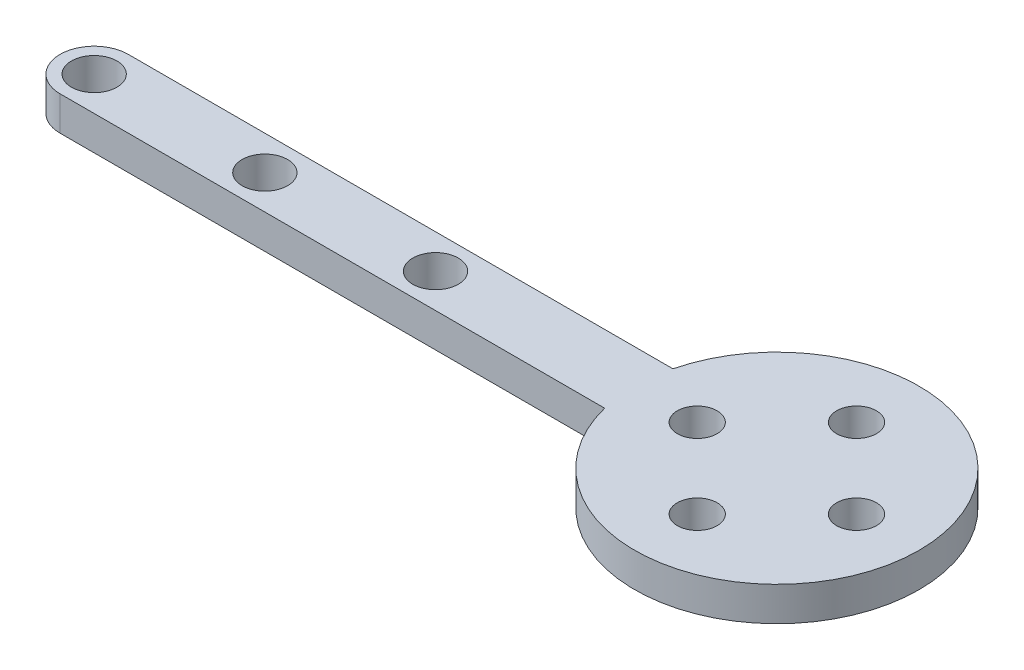
from build123d import *

# Parameters (mm, degrees)
SKETCH_1_R      = 1.75
SKETCH_1_R_2    = 2
EXTRUDE_1_DEPTH = 3


with BuildPart() as part:
    # 草图1 → 凸台-拉伸1 (new body)
    with BuildSketch(Plane(origin=(0, 0, 0), x_dir=(1, 0, 0), z_dir=(0, 1, 0))):
        with BuildLine():
            Line((-12.1346611, -3), (-60, -3))
            ThreePointArc((-60, -3), (-63, 0), (-60, 3))
            Line((-60, 3), (-12.1346611, 3))
            ThreePointArc((-12.1346611, 3), (12.5, 0), (-12.1346611, -3))
        make_face()
        with Locations((0, 7)):
            Circle(SKETCH_1_R, mode=Mode.SUBTRACT)
        with Locations((7, 0)):
            Circle(SKETCH_1_R, mode=Mode.SUBTRACT)
        with Locations((0, -7)):
            Circle(SKETCH_1_R, mode=Mode.SUBTRACT)
        with Locations((-7, 0)):
            Circle(SKETCH_1_R, mode=Mode.SUBTRACT)
        with Locations((-60, 0)):
            Circle(SKETCH_1_R_2, mode=Mode.SUBTRACT)
        with Locations((-30, 0)):
            Circle(SKETCH_1_R_2, mode=Mode.SUBTRACT)
        with Locations((-45, 0)):
            Circle(SKETCH_1_R_2, mode=Mode.SUBTRACT)
    extrude(amount=EXTRUDE_1_DEPTH)


solid = part.part
